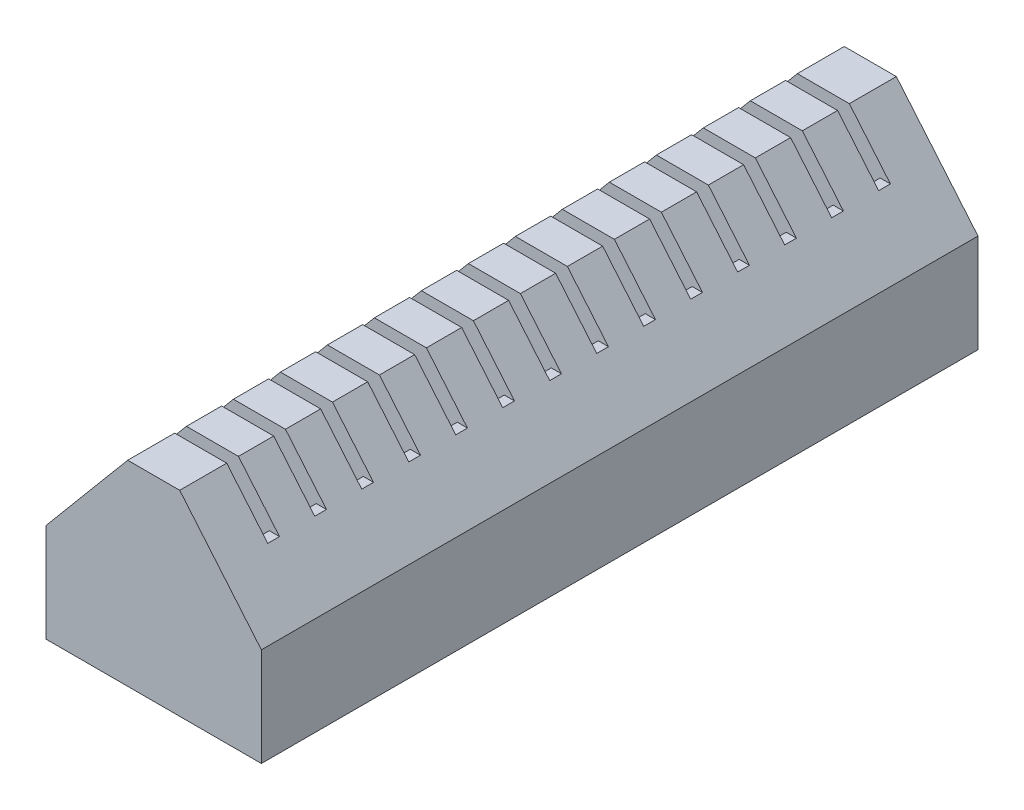
from build123d import *

# Parameters (mm, degrees)
AUFSATZ_LINEAR_AUSTRAGEN2_DEPTH      = 1.8
SCHNITT_LINEAR_AUSTRAGEN1_DEPTH      = 0.5
SCHNITT_LINEAR_AUSTRAGEN2_DEPTH      = 21.328305389
AUFSATZ_LINEAR_AUSTRAGEN3_DEPTH      = 1.2
LINEARES_MUSTER1_COUNT               = 15
LINEARES_MUSTER1_PITCH               = 4.8
AUFSATZ_LINEAR_AUSTRAGEN4_DEPTH      = 1.2
AUFSATZ_LINEAR_AUSTRAGEN4_DEPTH_BACK = 1.3
AUFSATZ_LINEAR_AUSTRAGEN5_DEPTH      = 1.2
AUFSATZ_LINEAR_AUSTRAGEN5_DEPTH_BACK = 0.8
AUFSATZ_LINEAR_START                 = -2.5
AUFSATZ_LINEAR_AUSTRAGEN7_DEPTH      = 2.5


with BuildPart() as part:
    # Skizze3 → Aufsatz-Linear austragen2 (new, symmetric)
    with BuildSketch(Plane.XY):
        Polygon((-11, -3), (-11, 7.057881962), (-2.657572421, 17), (2.657572421, 17), (11, 7.057881962), (11, -3), align=None)
    aufsatz_linear_austragen2 = extrude(amount=AUFSATZ_LINEAR_AUSTRAGEN2_DEPTH, both=True)

    # Skizze2 → Schnitt-Linear austragen1 (cut, symmetric)
    with BuildSketch(Plane.XY):
        Polygon((-8, 0), (8, 0), (8, 5.965971259), (0, 15.5), (-8, 5.965971259), align=None)
    schnitt_linear_austragen1 = extrude(amount=SCHNITT_LINEAR_AUSTRAGEN1_DEPTH, both=True, mode=Mode.SUBTRACT)

    # Skizze5 → Schnitt-Linear austragen2 (cut, symmetric)
    with BuildSketch(Plane.XY):
        Polygon((-0.75, 0), (0, 0.893815194), (0.75, 0), (0.75, -1.5), (-0.75, -1.5), align=None)
    schnitt_linear_austragen2 = extrude(amount=SCHNITT_LINEAR_AUSTRAGEN2_DEPTH, both=True, mode=Mode.SUBTRACT)

    # Skizze6 → Aufsatz-Linear austragen3 (add)
    with BuildSketch(Plane.XY.offset(1.8)):
        Polygon((-5.808744746, 12), (-6.853070577, 12), (-11, 7.057881962), (-11, -3), (11, -3), (11, 7.057881962), (6.853070577, 12), (5.808744746, 12), (10.2, 6.766705775), (10.2, 2), (-10.2, 2), (-10.2, 6.766705775), align=None)
        Polygon((-0.75, 0), (0, 0.893815194), (0.75, 0), (0.75, -1.5), (-0.75, -1.5), align=None, mode=Mode.SUBTRACT)
    aufsatz_linear_austragen3 = extrude(amount=AUFSATZ_LINEAR_AUSTRAGEN3_DEPTH)

    # Lineares Muster1: Aufsatz-Linear austragen2, Schnitt-Linear austragen1, Schnitt-Linear austragen2, Aufsatz-Linear austragen3 ×15
    with Locations(*[(0, 0, i * LINEARES_MUSTER1_PITCH) for i in range(1, LINEARES_MUSTER1_COUNT)]):
        add(aufsatz_linear_austragen2)
        add(schnitt_linear_austragen1, mode=Mode.SUBTRACT)
        add(schnitt_linear_austragen2, mode=Mode.SUBTRACT)
        add(aufsatz_linear_austragen3)

    # Skizze8 → Aufsatz-Linear austragen4 (add, two sides: drawn at the far end of the back side and taken through both)
    with BuildSketch(Plane(origin=(0, 0, -1.8), x_dir=(-1, 0, 0), z_dir=(0, 0, -1)).offset(-AUFSATZ_LINEAR_AUSTRAGEN4_DEPTH_BACK)):
        Polygon((11, -3), (11, 7.057881962), (2.657572421, 17), (-2.657572421, 17), (-11, 7.057881962), (-11, -3), align=None)
    extrude(amount=AUFSATZ_LINEAR_AUSTRAGEN4_DEPTH + AUFSATZ_LINEAR_AUSTRAGEN4_DEPTH_BACK)

    # Skizze9 → Aufsatz-Linear austragen5 (add, two sides: drawn at the far end of the back side and taken through both)
    with BuildSketch(Plane.XY.offset(69).offset(-AUFSATZ_LINEAR_AUSTRAGEN5_DEPTH_BACK)):
        Polygon((-2.657572421, 17), (-6.853070577, 12), (-5.808744746, 12), (-10.2, 6.766705775), (-10.2, 2), (10.2, 2), (10.2, 6.766705775), (5.808744746, 12), (6.853070577, 12), (2.657572421, 17), align=None)
    extrude(amount=AUFSATZ_LINEAR_AUSTRAGEN5_DEPTH + AUFSATZ_LINEAR_AUSTRAGEN5_DEPTH_BACK)

    # Skizze12 → Aufsatz-Linear austragen7 (add)
    with BuildSketch(Plane.XY.offset(70.2).offset(AUFSATZ_LINEAR_START)):
        Polygon((-0.75, -1.5), (-0.75, 0), (0, 0.893815194), (0.75, 0), (0.75, -1.5), align=None)
    extrude(amount=AUFSATZ_LINEAR_AUSTRAGEN7_DEPTH)


solid = part.part
